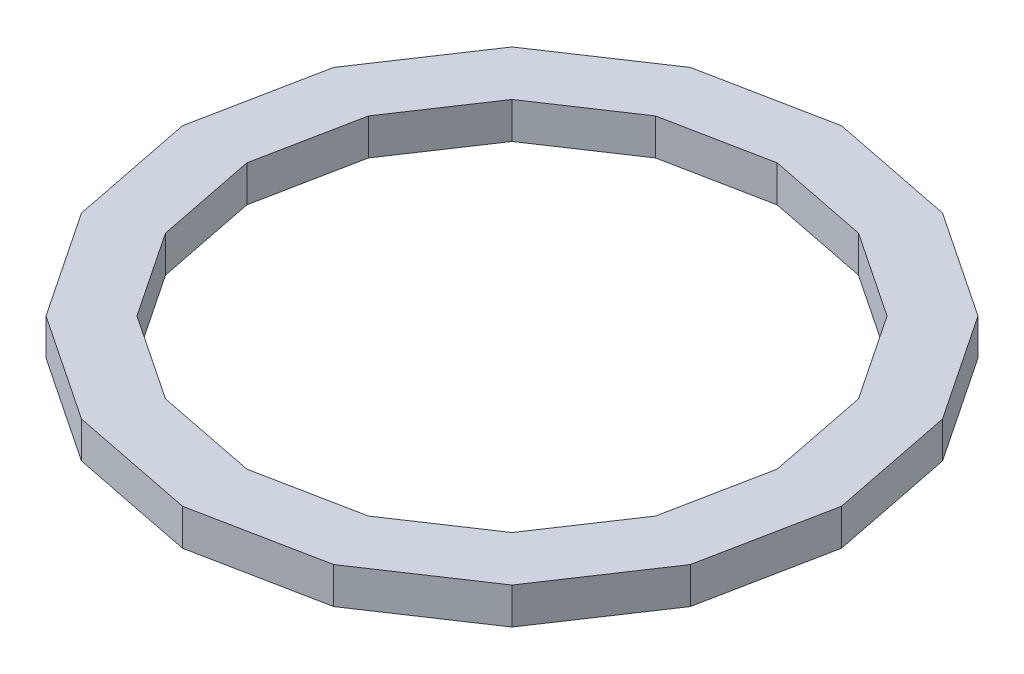
from build123d import *

# Parameters (mm, degrees)
BOSS_EXTRUDE1_DEPTH = 19.05


with BuildPart() as part:
    # Sketch1 → Boss-Extrude1 (new body)
    with BuildSketch(Plane(origin=(0, 0, 0), x_dir=(1, 0, 0), z_dir=(0, 1, 0))):
        Polygon((172.509838787, 0), (159.378309213, 66.016657224), (121.982876828, 121.982876828), (66.016657224, 159.378309213), (0, 172.509838787), (-66.016657224, 159.378309213), (-121.982876828, 121.982876828), (-159.378309213, 66.016657224), (-172.509838787, 0), (-159.378309213, -66.016657224), (-121.982876828, -121.982876828), (-66.016657224, -159.378309213), (0, -172.509838787), (66.016657224, -159.378309213), (121.982876828, -121.982876828), (159.378309213, -66.016657224), align=None)
        Polygon((138.842938743, 0), (128.274149339, 53.132892358), (98.176783505, 98.176783505), (53.132892358, 128.274149339), (0, 138.842938743), (-53.132892358, 128.274149339), (-98.176783505, 98.176783505), (-128.274149339, 53.132892358), (-138.842938743, 0), (-128.274149339, -53.132892358), (-98.176783505, -98.176783505), (-53.132892358, -128.274149339), (0, -138.842938743), (53.132892358, -128.274149339), (98.176783505, -98.176783505), (128.274149339, -53.132892358), align=None, mode=Mode.SUBTRACT)
    extrude(amount=BOSS_EXTRUDE1_DEPTH)


solid = part.part
